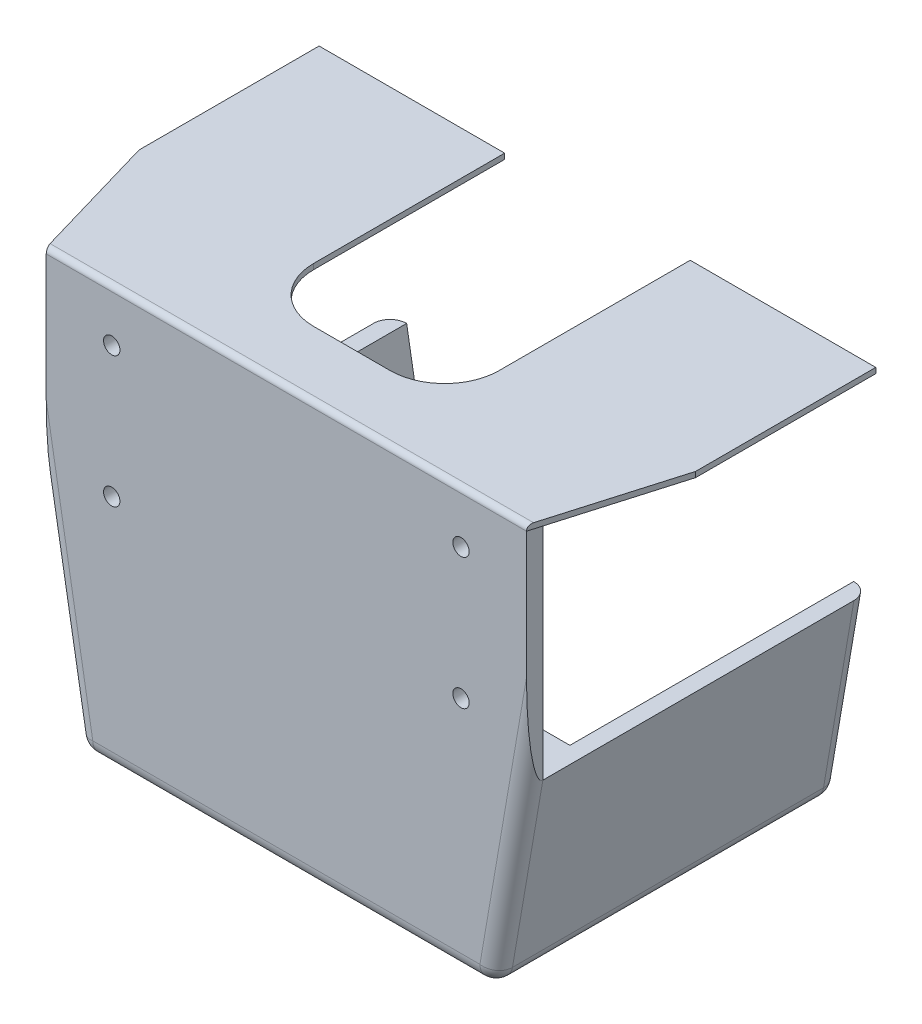
from build123d import *

# Parameters (mm, degrees)
SKETCH1_W           = 88
SKETCH1_H           = 41
BOSS_EXTRUDE1_DEPTH = 3
BOSS_EXTRUDE2_DEPTH = 3
BOSS_EXTRUDE3_DEPTH = 60
BOSS_EXTRUDE4_DEPTH = 1
FILLET1_R           = 10
SKETCH5_W           = 32
SKETCH5_H           = 3
BOSS_EXTRUDE5_DEPTH = 8
FILLET2_R           = 10
FILLET6_R           = 1
FILLET12_R          = 3
SKETCH6_W           = 81.912475118
SKETCH6_H           = 4
BOSS_EXTRUDE6_DEPTH = 8
SKETCH7_R           = 1.5
CUT_EXTRUDE1_DEPTH  = 3


with BuildPart() as part:
    # Sketch1 → Boss-Extrude1 (new body)
    with BuildSketch(Plane.XY):
        with Locations((44, 20.5)):
            Rectangle(SKETCH1_W, SKETCH1_H)
    extrude(amount=BOSS_EXTRUDE1_DEPTH)

    # Sketch2 → Boss-Extrude2 (add)
    with BuildSketch(Plane.XY.offset(3)):
        Polygon((0, 0), (88, 0), (82, -35), (6, -35), align=None)
    extrude(amount=-BOSS_EXTRUDE2_DEPTH)

    # Sketch3 → Boss-Extrude3 (add)
    with BuildSketch(Plane(origin=(0, 0, 0), x_dir=(-1, 0, 0), z_dir=(0, 0, -1))):
        Polygon((-82, -35), (-88, 0), (-84.956237559, 0), (-79.470523274, -32), (-60, -32), (-60, -35), align=None)
        Polygon((-28, -35), (-6, -35), (0, 0), (-3.043762441, 0), (-8.529476726, -32), (-28, -32), align=None)
    extrude(amount=BOSS_EXTRUDE3_DEPTH)

    # Sketch4 → Boss-Extrude4 (add)
    with BuildSketch(Plane(origin=(0, 41, 0), x_dir=(1, 0, 0), z_dir=(0, 1, 0))):
        Polygon((0, -3), (-7, 21), (-7, 54), (27, 54), (27, 9), (61, 9), (61, 54), (95, 54), (95, 21), (88, -3), align=None)
    extrude(amount=BOSS_EXTRUDE4_DEPTH)

    # Fillet1
    fillet1_edges = [part.edges().sort_by_distance(p)[0] for p in [
        (61, 41.5, -9),
        (27, 41.5, -9),
    ]]
    fillet(fillet1_edges, radius=FILLET1_R)

    # Sketch5 → Boss-Extrude5 (add)
    with BuildSketch(Plane(origin=(0, 0, 0), x_dir=(-1, 0, 0), z_dir=(0, 0, -1))):
        with Locations((-44, -33.5)):
            Rectangle(SKETCH5_W, SKETCH5_H)
    extrude(amount=BOSS_EXTRUDE5_DEPTH)

    # Fillet2
    fillet2_edges = [part.edges().sort_by_distance(p)[0] for p in [
        (60, -33.5, -8),
        (28, -33.5, -8),
    ]]
    fillet(fillet2_edges, radius=FILLET2_R)

    # Fillet6
    fillet6_edges = [part.edges().sort_by_distance(p)[0] for p in [
        (44, 42, 3),
    ]]
    fillet(fillet6_edges, radius=FILLET6_R)

    # Fillet12
    fillet12_edges = [part.edges().sort_by_distance(p)[0] for p in [
        (85, -17.5, -60),
        (60, -33.5, -60),
        (28, -33.5, -60),
        (3, -17.5, -60),
        (3, -17.5, 3),
        (85, -17.5, 3),
        (71, -35, -60),
        (17, -35, -60),
        (82, -35, -28.5),
        (6, -35, -28.5),
        (44, -35, 3),
    ]]
    fillet(fillet12_edges, radius=FILLET12_R - 0.0001)  # a hair under: the kernel refuses the full size

    # Sketch6 → Boss-Extrude6 (add)
    with BuildSketch(Plane(origin=(0, 0, 0), x_dir=(-1, 0, 0), z_dir=(0, 0, -1))):
        with Locations((-44, -2)):
            Rectangle(SKETCH6_W, SKETCH6_H)
    extrude(amount=BOSS_EXTRUDE6_DEPTH)

    # Sketch7 → Cut-Extrude1 (cut)
    with BuildSketch(Plane(origin=(0, 0, 0), x_dir=(-1, 0, 0), z_dir=(0, 0, -1))):
        with Locations((-12, 32.5)):
            Circle(SKETCH7_R)
        with Locations(Location((-76, 32.5, 0), (0, 0, 180))):
            Circle(SKETCH7_R)
        with Locations((-76, 8.5)):
            Circle(SKETCH7_R)
        with Locations(Location((-12, 8.5, 0), (0, 0, 180))):
            Circle(SKETCH7_R)
    extrude(amount=-CUT_EXTRUDE1_DEPTH, mode=Mode.SUBTRACT)


solid = part.part
